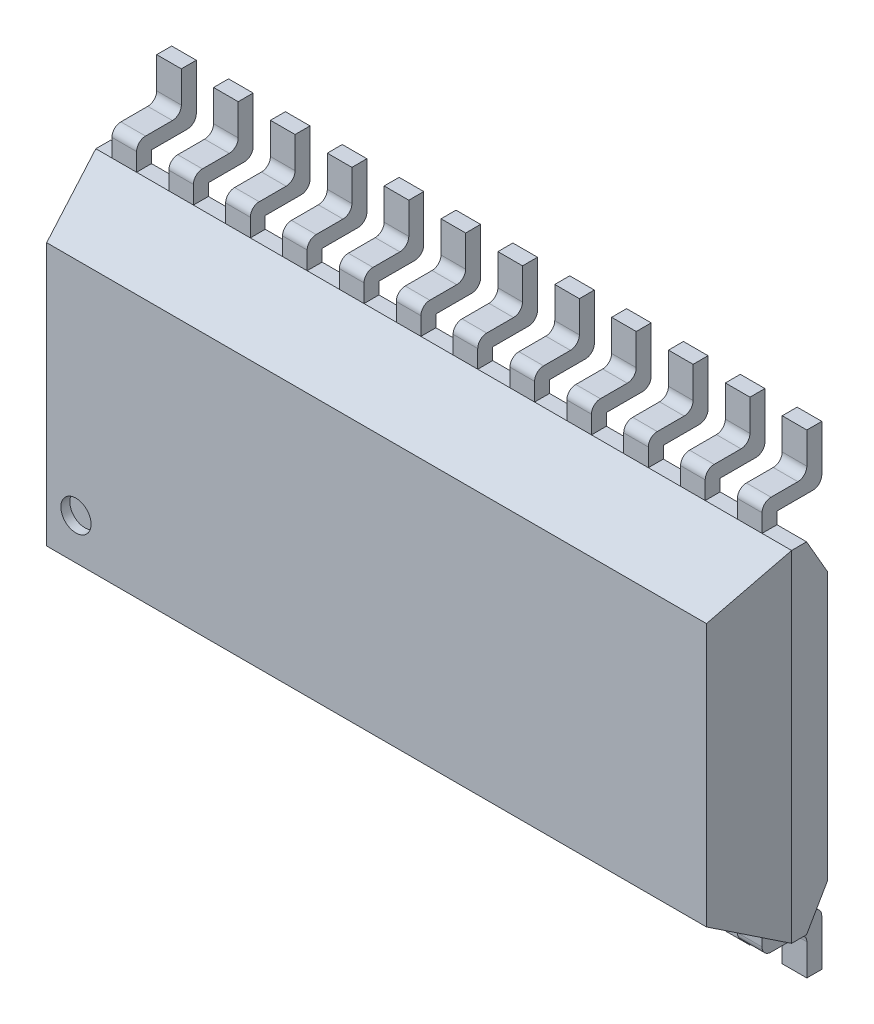
from build123d import *
from OCP.BRepFilletAPI import BRepFilletAPI_MakeChamfer

# Parameters (mm, degrees)
SKETCH_1_W                     = 15.54
SKETCH_1_H                     = 7.6
EXTRUDE_1_DEPTH                = 2.7
CHAMFER_1_SIZE                 = 1.5
CHAMFER_1_SIZE2                = 0.866025
CHAMFER_2_SIZE                 = 1.5
CHAMFER_2_SIZE2                = 0.401924
SKETCH_2_W                     = 0.55
SKETCH_2_H                     = 0.333975
FILLET_1_R                     = 0.2
PATTERN_LINEAR_1_COUNT         = 5
PATTERN_LINEAR_1_PITCH         = 1.27
FILLET_1_OF_PATTERN_LINEAR_1_R = 0.2
PATTERN_LINEAR_2_COUNT         = 8
PATTERN_LINEAR_2_PITCH         = 1.27
FILLET_1_OF_PATTERN_LINEAR_2_R = 0.2
MIRROR_START                   = 0.36
MIRROR_1_DEPTH                 = 0.55
MIRROR_START_2                 = 1.63
MIRROR_1_2_DEPTH               = 0.55
MIRROR_START_3                 = 2.9
MIRROR_1_3_DEPTH               = 0.55
MIRROR_START_4                 = 4.17
MIRROR_1_4_DEPTH               = 0.55
MIRROR_START_5                 = 5.44
MIRROR_1_5_DEPTH               = 0.55
MIRROR_START_6                 = 6.71
MIRROR_1_6_DEPTH               = 0.55
MIRROR_START_7                 = 7.98
MIRROR_1_7_DEPTH               = 0.55
MIRROR_START_8                 = 9.25
MIRROR_1_8_DEPTH               = 0.55
MIRROR_START_9                 = 10.52
MIRROR_1_9_DEPTH               = 0.55
MIRROR_START_10                = 11.79
MIRROR_1_10_DEPTH              = 0.55
MIRROR_START_11                = 13.06
MIRROR_1_11_DEPTH              = 0.55
MIRROR_START_12                = 14.33
MIRROR_1_12_DEPTH              = 0.55
SKETCH_4_R                     = 0.337581
CUT_EXTRUDE_1_DEPTH            = 0.2


# Read off the part's stored shape, not the designer's step: 镜向1
with BuildPart() as part:
    # 草图1 → 凸台-拉伸1 (new body)
    with BuildSketch(Plane.XY):
        with Locations((7.77, 3.8)):
            Rectangle(SKETCH_1_W, SKETCH_1_H)
    extrude(amount=EXTRUDE_1_DEPTH)

    # 倒角1: one chamfer whose edges measure the first distance from different faces: ONE call of the kernel's chamfer builder (chamfer() names one face for all edges)
    chamfer_1_edges_1 = [part.edges().sort_by_distance(p)[0] for p in [
        (7.77, 0, 2.7),
    ]]
    chamfer_1_side_1 = [part.faces().sort_by_distance(p)[0] for p in [
        (7.77, 0, 1.35),
    ]]
    chamfer_1_edges_2 = [part.edges().sort_by_distance(p)[0] for p in [
        (7.77, 7.6, 2.7),
    ]]
    chamfer_1_side_2 = [part.faces().sort_by_distance(p)[0] for p in [
        (7.77, 7.6, 1.35),
    ]]
    chamfer_1_edges_3 = [part.edges().sort_by_distance(p)[0] for p in [
        (7.77, 0, 0),
        (7.77, 7.6, 0),
    ]]
    chamfer_1_side_3 = [part.faces().sort_by_distance(p)[0] for p in [
        (7.77, 3.8, 0),
    ]]
    chamfer_1 = BRepFilletAPI_MakeChamfer(part.part.solid().wrapped)
    for e in chamfer_1_edges_1:
        chamfer_1.Add(CHAMFER_1_SIZE, CHAMFER_1_SIZE2, e.wrapped, chamfer_1_side_1[0].wrapped)  # the first distance lies on this face
    for e in chamfer_1_edges_2:
        chamfer_1.Add(CHAMFER_1_SIZE, CHAMFER_1_SIZE2, e.wrapped, chamfer_1_side_2[0].wrapped)  # the first distance lies on this face
    for e in chamfer_1_edges_3:
        chamfer_1.Add(CHAMFER_1_SIZE, CHAMFER_1_SIZE2, e.wrapped, chamfer_1_side_3[0].wrapped)  # the first distance lies on this face
    add(Compound.cast(chamfer_1.Shape()), mode=Mode.REPLACE)

    # 倒角2: one chamfer whose edges measure the first distance from different faces: ONE call of the kernel's chamfer builder (chamfer() names one face for all edges)
    chamfer_2_edges_1 = [part.edges().sort_by_distance(p)[0] for p in [
        (0, 3.8, 0),
        (15.54, 3.8, 0),
    ]]
    chamfer_2_side_1 = [part.faces().sort_by_distance(p)[0] for p in [
        (7.77, 3.8, 0),
    ]]
    chamfer_2_edges_2 = [part.edges().sort_by_distance(p)[0] for p in [
        (0, 3.8, 2.7),
    ]]
    chamfer_2_side_2 = [part.faces().sort_by_distance(p)[0] for p in [
        (0, 3.8, 1.365317),
    ]]
    chamfer_2_edges_3 = [part.edges().sort_by_distance(p)[0] for p in [
        (15.54, 3.8, 2.7),
    ]]
    chamfer_2_side_3 = [part.faces().sort_by_distance(p)[0] for p in [
        (15.54, 3.8, 1.365317),
    ]]
    chamfer_2 = BRepFilletAPI_MakeChamfer(part.part.solid().wrapped)
    for e in chamfer_2_edges_1:
        chamfer_2.Add(CHAMFER_2_SIZE, CHAMFER_2_SIZE2, e.wrapped, chamfer_2_side_1[0].wrapped)  # the first distance lies on this face
    for e in chamfer_2_edges_2:
        chamfer_2.Add(CHAMFER_2_SIZE, CHAMFER_2_SIZE2, e.wrapped, chamfer_2_side_2[0].wrapped)  # the first distance lies on this face
    for e in chamfer_2_edges_3:
        chamfer_2.Add(CHAMFER_2_SIZE, CHAMFER_2_SIZE2, e.wrapped, chamfer_2_side_3[0].wrapped)  # the first distance lies on this face
    add(Compound.cast(chamfer_2.Shape()), mode=Mode.REPLACE)

    # 扫描1: sweep along a path in 草图3
    with BuildLine(Plane(origin=(5.7, 0, 0), x_dir=(0, 0, -1), z_dir=(1, 0, 0))) as sweep_1_path:
        Line((-1.2, 7.6), (-1.2, 8.2))
        Line((-1.2, 8.2), (-0.2, 8.2))
        Line((-0.2, 8.2), (-0.2, 9.1))
    # 草图2 → 扫描1 (sweep)
    with BuildSketch(Plane(origin=(0, 7.6, 0), x_dir=(1, 0, 0), z_dir=(0, 1, 0))):
        with Locations((5.715, -1.033012)):
            Rectangle(SKETCH_2_W, SKETCH_2_H)
    sweep_1 = sweep(path=sweep_1_path.line, transition=Transition.RIGHT)

    # 圆角1
    fillet_1_edges = [part.edges().sort_by_distance(p)[0] for p in [
        (5.715, 7.866025, -0.133975),
        (5.715, 8.2, 0.2),
        (5.715, 8.2, 1.2),
    ]]
    fillet(fillet_1_edges, radius=FILLET_1_R)

    # 阵列(线性)1: 扫描1 ×5
    with Locations(*[(-i * PATTERN_LINEAR_1_PITCH, 0, 0) for i in range(1, PATTERN_LINEAR_1_COUNT)]):
        add(sweep_1)

    # 圆角1 of 阵列(线性)1
    fillet_1_of_pattern_linear_1_edges = [part.edges().sort_by_distance(p)[0] for p in [
        (4.445, 7.866025, -0.133975),
        (4.445, 8.2, 0.2),
        (4.445, 8.2, 1.2),
        (3.175, 7.866025, -0.133975),
        (3.175, 8.2, 0.2),
        (3.175, 8.2, 1.2),
        (1.905, 7.866025, -0.133975),
        (1.905, 8.2, 0.2),
        (1.905, 8.2, 1.2),
        (0.635, 7.866025, -0.133975),
        (0.635, 8.2, 0.2),
        (0.635, 8.2, 1.2),
    ]]
    fillet(fillet_1_of_pattern_linear_1_edges, radius=FILLET_1_OF_PATTERN_LINEAR_1_R)

    # 阵列(线性)2: 扫描1 ×8
    with Locations(*[(i * PATTERN_LINEAR_2_PITCH, 0, 0) for i in range(1, PATTERN_LINEAR_2_COUNT)]):
        add(sweep_1)

    # 圆角1 of 阵列(线性)2
    fillet_1_of_pattern_linear_2_edges = [part.edges().sort_by_distance(p)[0] for p in [
        (6.985, 7.866025, -0.133975),
        (6.985, 8.2, 0.2),
        (6.985, 8.2, 1.2),
        (8.255, 7.866025, -0.133975),
        (8.255, 8.2, 0.2),
        (8.255, 8.2, 1.2),
        (9.525, 7.866025, -0.133975),
        (9.525, 8.2, 0.2),
        (9.525, 8.2, 1.2),
        (10.795, 7.866025, -0.133975),
        (10.795, 8.2, 0.2),
        (10.795, 8.2, 1.2),
        (12.065, 7.866025, -0.133975),
        (12.065, 8.2, 0.2),
        (12.065, 8.2, 1.2),
        (13.335, 7.866025, -0.133975),
        (13.335, 8.2, 0.2),
        (13.335, 8.2, 1.2),
        (14.605, 7.866025, -0.133975),
        (14.605, 8.2, 0.2),
        (14.605, 8.2, 1.2),
    ]]
    fillet(fillet_1_of_pattern_linear_2_edges, radius=FILLET_1_OF_PATTERN_LINEAR_2_R)

    # 镜向1 outline → 镜向1 (add)
    with BuildSketch(Plane.YZ.offset(MIRROR_START)):
        with BuildLine():
            Line((-1.5, 0.2), (-1.5, -0.133975))
            Line((-1.5, -0.133975), (-0.466025, -0.133975))
            ThreePointArc((-0.466025, -0.133975), (-0.324604, -0.075396), (-0.266025, 0.066025))
            Line((-0.266025, 0.066025), (-0.266025, 0.866025))
            Line((-0.266025, 0.866025), (0, 0.866025))
            Line((0, 0.866025), (0, 1.2))
            Line((0, 1.2), (-0.4, 1.2))
            ThreePointArc((-0.4, 1.2), (-0.541421, 1.141421), (-0.6, 1))
            Line((-0.6, 1), (-0.6, 0.4))
            ThreePointArc((-0.6, 0.4), (-0.658579, 0.258579), (-0.8, 0.2))
            Line((-0.8, 0.2), (-1.5, 0.2))
        make_face()
    extrude(amount=MIRROR_1_DEPTH)

    # Mirror 1 2 outline → Mirror 1 2 (add)
    with BuildSketch(Plane.YZ.offset(MIRROR_START_2)):
        with BuildLine():
            Line((-1.5, 0.2), (-1.5, -0.133975))
            Line((-1.5, -0.133975), (-0.466025, -0.133975))
            ThreePointArc((-0.466025, -0.133975), (-0.324604, -0.075396), (-0.266025, 0.066025))
            Line((-0.266025, 0.066025), (-0.266025, 0.866025))
            Line((-0.266025, 0.866025), (0, 0.866025))
            Line((0, 0.866025), (0, 1.2))
            Line((0, 1.2), (-0.4, 1.2))
            ThreePointArc((-0.4, 1.2), (-0.541421, 1.141421), (-0.6, 1))
            Line((-0.6, 1), (-0.6, 0.4))
            ThreePointArc((-0.6, 0.4), (-0.658579, 0.258579), (-0.8, 0.2))
            Line((-0.8, 0.2), (-1.5, 0.2))
        make_face()
    extrude(amount=MIRROR_1_2_DEPTH)

    # Mirror 1 3 outline → Mirror 1 3 (add)
    with BuildSketch(Plane.YZ.offset(MIRROR_START_3)):
        with BuildLine():
            Line((-1.5, 0.2), (-1.5, -0.133975))
            Line((-1.5, -0.133975), (-0.466025, -0.133975))
            ThreePointArc((-0.466025, -0.133975), (-0.324604, -0.075396), (-0.266025, 0.066025))
            Line((-0.266025, 0.066025), (-0.266025, 0.866025))
            Line((-0.266025, 0.866025), (0, 0.866025))
            Line((0, 0.866025), (0, 1.2))
            Line((0, 1.2), (-0.4, 1.2))
            ThreePointArc((-0.4, 1.2), (-0.541421, 1.141421), (-0.6, 1))
            Line((-0.6, 1), (-0.6, 0.4))
            ThreePointArc((-0.6, 0.4), (-0.658579, 0.258579), (-0.8, 0.2))
            Line((-0.8, 0.2), (-1.5, 0.2))
        make_face()
    extrude(amount=MIRROR_1_3_DEPTH)

    # Mirror 1 4 outline → Mirror 1 4 (add)
    with BuildSketch(Plane.YZ.offset(MIRROR_START_4)):
        with BuildLine():
            Line((-1.5, 0.2), (-1.5, -0.133975))
            Line((-1.5, -0.133975), (-0.466025, -0.133975))
            ThreePointArc((-0.466025, -0.133975), (-0.324604, -0.075396), (-0.266025, 0.066025))
            Line((-0.266025, 0.066025), (-0.266025, 0.866025))
            Line((-0.266025, 0.866025), (0, 0.866025))
            Line((0, 0.866025), (0, 1.2))
            Line((0, 1.2), (-0.4, 1.2))
            ThreePointArc((-0.4, 1.2), (-0.541421, 1.141421), (-0.6, 1))
            Line((-0.6, 1), (-0.6, 0.4))
            ThreePointArc((-0.6, 0.4), (-0.658579, 0.258579), (-0.8, 0.2))
            Line((-0.8, 0.2), (-1.5, 0.2))
        make_face()
    extrude(amount=MIRROR_1_4_DEPTH)

    # Mirror 1 5 outline → Mirror 1 5 (add)
    with BuildSketch(Plane.YZ.offset(MIRROR_START_5)):
        with BuildLine():
            Line((-1.5, 0.2), (-1.5, -0.133975))
            Line((-1.5, -0.133975), (-0.466025, -0.133975))
            ThreePointArc((-0.466025, -0.133975), (-0.324604, -0.075396), (-0.266025, 0.066025))
            Line((-0.266025, 0.066025), (-0.266025, 0.866025))
            Line((-0.266025, 0.866025), (0, 0.866025))
            Line((0, 0.866025), (0, 1.2))
            Line((0, 1.2), (-0.4, 1.2))
            ThreePointArc((-0.4, 1.2), (-0.541421, 1.141421), (-0.6, 1))
            Line((-0.6, 1), (-0.6, 0.4))
            ThreePointArc((-0.6, 0.4), (-0.658579, 0.258579), (-0.8, 0.2))
            Line((-0.8, 0.2), (-1.5, 0.2))
        make_face()
    extrude(amount=MIRROR_1_5_DEPTH)

    # Mirror 1 6 outline → Mirror 1 6 (add)
    with BuildSketch(Plane.YZ.offset(MIRROR_START_6)):
        with BuildLine():
            Line((-1.5, 0.2), (-1.5, -0.133975))
            Line((-1.5, -0.133975), (-0.466025, -0.133975))
            ThreePointArc((-0.466025, -0.133975), (-0.324604, -0.075396), (-0.266025, 0.066025))
            Line((-0.266025, 0.066025), (-0.266025, 0.866025))
            Line((-0.266025, 0.866025), (0, 0.866025))
            Line((0, 0.866025), (0, 1.2))
            Line((0, 1.2), (-0.4, 1.2))
            ThreePointArc((-0.4, 1.2), (-0.541421, 1.141421), (-0.6, 1))
            Line((-0.6, 1), (-0.6, 0.4))
            ThreePointArc((-0.6, 0.4), (-0.658579, 0.258579), (-0.8, 0.2))
            Line((-0.8, 0.2), (-1.5, 0.2))
        make_face()
    extrude(amount=MIRROR_1_6_DEPTH)

    # Mirror 1 7 outline → Mirror 1 7 (add)
    with BuildSketch(Plane.YZ.offset(MIRROR_START_7)):
        with BuildLine():
            Line((-1.5, 0.2), (-1.5, -0.133975))
            Line((-1.5, -0.133975), (-0.466025, -0.133975))
            ThreePointArc((-0.466025, -0.133975), (-0.324604, -0.075396), (-0.266025, 0.066025))
            Line((-0.266025, 0.066025), (-0.266025, 0.866025))
            Line((-0.266025, 0.866025), (0, 0.866025))
            Line((0, 0.866025), (0, 1.2))
            Line((0, 1.2), (-0.4, 1.2))
            ThreePointArc((-0.4, 1.2), (-0.541421, 1.141421), (-0.6, 1))
            Line((-0.6, 1), (-0.6, 0.4))
            ThreePointArc((-0.6, 0.4), (-0.658579, 0.258579), (-0.8, 0.2))
            Line((-0.8, 0.2), (-1.5, 0.2))
        make_face()
    extrude(amount=MIRROR_1_7_DEPTH)

    # Mirror 1 8 outline → Mirror 1 8 (add)
    with BuildSketch(Plane.YZ.offset(MIRROR_START_8)):
        with BuildLine():
            Line((-1.5, 0.2), (-1.5, -0.133975))
            Line((-1.5, -0.133975), (-0.466025, -0.133975))
            ThreePointArc((-0.466025, -0.133975), (-0.324604, -0.075396), (-0.266025, 0.066025))
            Line((-0.266025, 0.066025), (-0.266025, 0.866025))
            Line((-0.266025, 0.866025), (0, 0.866025))
            Line((0, 0.866025), (0, 1.2))
            Line((0, 1.2), (-0.4, 1.2))
            ThreePointArc((-0.4, 1.2), (-0.541421, 1.141421), (-0.6, 1))
            Line((-0.6, 1), (-0.6, 0.4))
            ThreePointArc((-0.6, 0.4), (-0.658579, 0.258579), (-0.8, 0.2))
            Line((-0.8, 0.2), (-1.5, 0.2))
        make_face()
    extrude(amount=MIRROR_1_8_DEPTH)

    # Mirror 1 9 outline → Mirror 1 9 (add)
    with BuildSketch(Plane.YZ.offset(MIRROR_START_9)):
        with BuildLine():
            Line((-1.5, 0.2), (-1.5, -0.133975))
            Line((-1.5, -0.133975), (-0.466025, -0.133975))
            ThreePointArc((-0.466025, -0.133975), (-0.324604, -0.075396), (-0.266025, 0.066025))
            Line((-0.266025, 0.066025), (-0.266025, 0.866025))
            Line((-0.266025, 0.866025), (0, 0.866025))
            Line((0, 0.866025), (0, 1.2))
            Line((0, 1.2), (-0.4, 1.2))
            ThreePointArc((-0.4, 1.2), (-0.541421, 1.141421), (-0.6, 1))
            Line((-0.6, 1), (-0.6, 0.4))
            ThreePointArc((-0.6, 0.4), (-0.658579, 0.258579), (-0.8, 0.2))
            Line((-0.8, 0.2), (-1.5, 0.2))
        make_face()
    extrude(amount=MIRROR_1_9_DEPTH)

    # Mirror 1 10 outline → Mirror 1 10 (add)
    with BuildSketch(Plane.YZ.offset(MIRROR_START_10)):
        with BuildLine():
            Line((-1.5, 0.2), (-1.5, -0.133975))
            Line((-1.5, -0.133975), (-0.466025, -0.133975))
            ThreePointArc((-0.466025, -0.133975), (-0.324604, -0.075396), (-0.266025, 0.066025))
            Line((-0.266025, 0.066025), (-0.266025, 0.866025))
            Line((-0.266025, 0.866025), (0, 0.866025))
            Line((0, 0.866025), (0, 1.2))
            Line((0, 1.2), (-0.4, 1.2))
            ThreePointArc((-0.4, 1.2), (-0.541421, 1.141421), (-0.6, 1))
            Line((-0.6, 1), (-0.6, 0.4))
            ThreePointArc((-0.6, 0.4), (-0.658579, 0.258579), (-0.8, 0.2))
            Line((-0.8, 0.2), (-1.5, 0.2))
        make_face()
    extrude(amount=MIRROR_1_10_DEPTH)

    # Mirror 1 11 outline → Mirror 1 11 (add)
    with BuildSketch(Plane.YZ.offset(MIRROR_START_11)):
        with BuildLine():
            Line((-1.5, 0.2), (-1.5, -0.133975))
            Line((-1.5, -0.133975), (-0.466025, -0.133975))
            ThreePointArc((-0.466025, -0.133975), (-0.324604, -0.075396), (-0.266025, 0.066025))
            Line((-0.266025, 0.066025), (-0.266025, 0.866025))
            Line((-0.266025, 0.866025), (0, 0.866025))
            Line((0, 0.866025), (0, 1.2))
            Line((0, 1.2), (-0.4, 1.2))
            ThreePointArc((-0.4, 1.2), (-0.541421, 1.141421), (-0.6, 1))
            Line((-0.6, 1), (-0.6, 0.4))
            ThreePointArc((-0.6, 0.4), (-0.658579, 0.258579), (-0.8, 0.2))
            Line((-0.8, 0.2), (-1.5, 0.2))
        make_face()
    extrude(amount=MIRROR_1_11_DEPTH)

    # Mirror 1 12 outline → Mirror 1 12 (add)
    with BuildSketch(Plane.YZ.offset(MIRROR_START_12)):
        with BuildLine():
            Line((-1.5, 0.2), (-1.5, -0.133975))
            Line((-1.5, -0.133975), (-0.466025, -0.133975))
            ThreePointArc((-0.466025, -0.133975), (-0.324604, -0.075396), (-0.266025, 0.066025))
            Line((-0.266025, 0.066025), (-0.266025, 0.866025))
            Line((-0.266025, 0.866025), (0, 0.866025))
            Line((0, 0.866025), (0, 1.2))
            Line((0, 1.2), (-0.4, 1.2))
            ThreePointArc((-0.4, 1.2), (-0.541421, 1.141421), (-0.6, 1))
            Line((-0.6, 1), (-0.6, 0.4))
            ThreePointArc((-0.6, 0.4), (-0.658579, 0.258579), (-0.8, 0.2))
            Line((-0.8, 0.2), (-1.5, 0.2))
        make_face()
    extrude(amount=MIRROR_1_12_DEPTH)

    # 草图4 → 切除-拉伸1 (cut)
    with BuildSketch(Plane.XY.offset(2.7)):
        with Locations((1.056199, 1.782809)):
            Circle(SKETCH_4_R)
    extrude(amount=-CUT_EXTRUDE_1_DEPTH, mode=Mode.SUBTRACT)


solid = part.part
